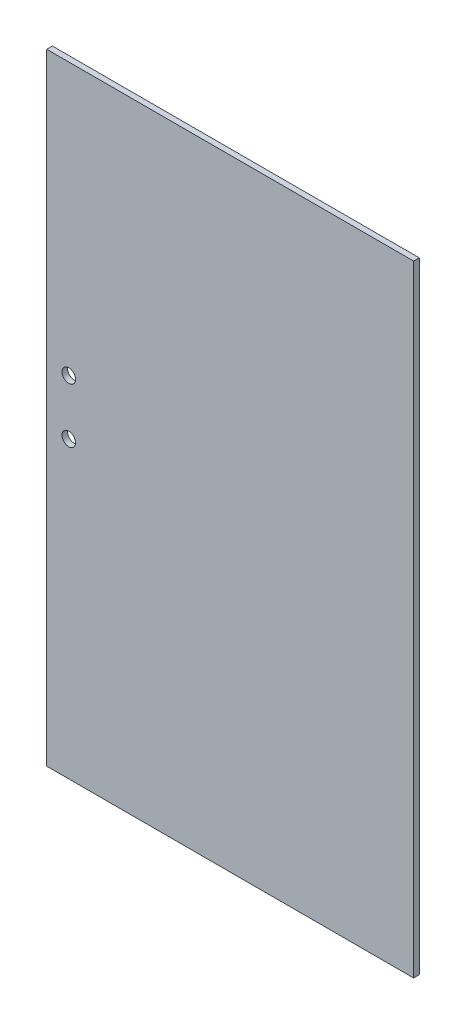
from build123d import *

# Parameters (mm, degrees)
SKETCH1_W          = 325
SKETCH1_H          = 550
SKETCH1_R          = 6
BASE_FLANGE1_DEPTH = 5


# Sheet-metal steps are written as plain solids
with BuildPart() as part:
    # Sketch1 → Base-Flange1 (new body)
    with BuildSketch(Plane.XY):
        Rectangle(SKETCH1_W, SKETCH1_H)
        with Locations(Location((-143, -14.218036313, 0), (0, 0, 180))):
            Circle(SKETCH1_R, mode=Mode.SUBTRACT)
        with Locations(Location((-143, 34.435225531, 0), (0, 0, 180))):
            Circle(SKETCH1_R, mode=Mode.SUBTRACT)
    extrude(amount=-BASE_FLANGE1_DEPTH)


solid = part.part
